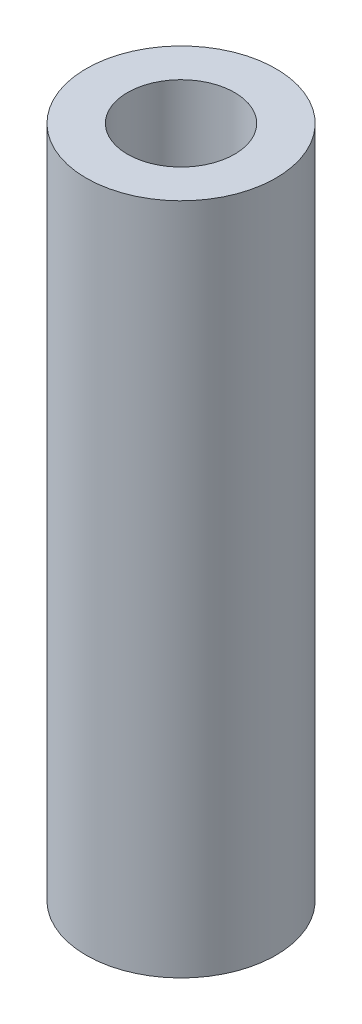
from build123d import *

# Parameters (mm, degrees)
SZKIC1_W = 27
SZKIC1_H = 440


with BuildPart() as part:
    # Szkic1 → Obrót1 (revolve)
    with BuildSketch(Plane.XY):
        with Locations((48.5, 0)):
            Rectangle(SZKIC1_W, SZKIC1_H)
    revolve(axis=Axis((0, 344.744344029, 0), (0, -1, 0)))


solid = part.part
